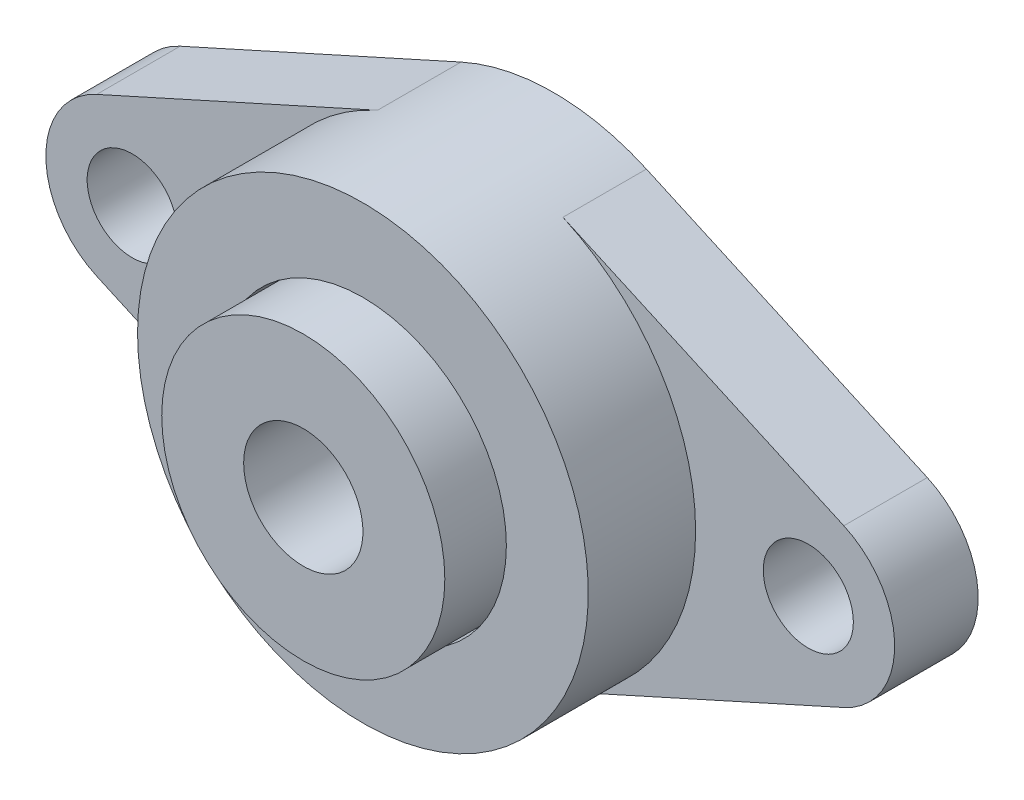
from build123d import *
from build123d.topology import SkipClean

# Parameters (mm, degrees)
SKETCH1_R        = 5.9944
EXTRUDE1_DEPTH   = 11.1125
EXTRUDE1_2_DEPTH = 11.1125
EXTRUDE2_DEPTH   = 11.1125


with BuildPart() as part:
    # Sketch1 → Extrude1 (new body)
    with BuildSketch(Plane.XY):
        with BuildLine():
            Line((-44.9961, 11.4935), (-27.708184071, 11.4935))
            ThreePointArc((-27.708184071, 11.4935), (-29.9974, 0), (-27.708184071, -11.4935))
            Line((-27.708184071, -11.4935), (-44.9961, -11.4935))
            ThreePointArc((-44.9961, -11.4935), (-56.4896, 0), (-44.9961, 11.4935))
        make_face()
        with Locations((-44.9961, 0)):
            Circle(SKETCH1_R, mode=Mode.SUBTRACT)
    extrude(amount=EXTRUDE1_DEPTH)



with BuildPart() as body_2:
    # Sketch1 → Extrude1 2 (new body)
    with BuildSketch(Plane.XY):
        with BuildLine():
            Line((44.9961, 11.4935), (27.708184071, 11.4935))
            ThreePointArc((27.708184071, 11.4935), (29.9974, 0), (27.708184071, -11.4935))
            Line((27.708184071, -11.4935), (44.9961, -11.4935))
            ThreePointArc((44.9961, -11.4935), (56.4896, 0), (44.9961, 11.4935))
        make_face()
        with Locations((44.9961, 0)):
            Circle(SKETCH1_R, mode=Mode.SUBTRACT)
    extrude(amount=EXTRUDE1_2_DEPTH)


with BuildPart() as part_1:
    with SkipClean():  # the faces are left unmerged after this step: merging them gives an invalid solid
        add(part.part)

        add(body_2.part)  # Extrude2 merges body 2
        # Sketch2 → Extrude2 (add)
        with BuildSketch(Plane.XY):
            with BuildLine():
                Line((-49.72261129, 10.476670906), (-12.335933333, 27.343532244))
                ThreePointArc((-12.335933333, 27.343532244), (-21.533432499, 20.884331245), (-27.708184071, 11.4935))
                Line((-27.708184071, 11.4935), (-44.9961, 11.4935))
                ThreePointArc((-44.9961, 11.4935), (-47.413425505, 11.236417563), (-49.72261129, 10.476670906))
            make_face()
            with BuildLine():
                Line((-44.9961, -11.4935), (-27.708184071, -11.4935))
                ThreePointArc((-27.708184071, -11.4935), (-21.533432499, -20.884331245), (-12.335933333, -27.343532244))
                Line((-12.335933333, -27.343532244), (-49.72261129, -10.476670906))
                ThreePointArc((-49.72261129, -10.476670906), (-47.413425505, -11.236417563), (-44.9961, -11.4935))
            make_face()
            with BuildLine():
                Line((12.335933333, 27.343532244), (49.72261129, 10.476670906))
                ThreePointArc((49.72261129, 10.476670906), (47.413425505, 11.236417563), (44.9961, 11.4935))
                Line((44.9961, 11.4935), (27.708184071, 11.4935))
                ThreePointArc((27.708184071, 11.4935), (21.533432499, 20.884331245), (12.335933333, 27.343532244))
            make_face()
            with BuildLine():
                Line((49.72261129, -10.476670906), (12.335933333, -27.343532244))
                ThreePointArc((12.335933333, -27.343532244), (21.533432499, -20.884331245), (27.708184071, -11.4935))
                Line((27.708184071, -11.4935), (44.9961, -11.4935))
                ThreePointArc((44.9961, -11.4935), (47.413425505, -11.236417563), (49.72261129, -10.476670906))
            make_face()
        extrude(amount=EXTRUDE2_DEPTH)

    # Sketch3 → Revolve1 (revolve)
    with BuildSketch(Plane(origin=(0, 0, 0), x_dir=(0, 0, -1), z_dir=(1, 0, 0))):
        with BuildLine():
            Line((0, 29.9974), (-25.4, 29.9974))
            Line((-25.4, 29.9974), (-25.4, 19.09445))
            Line((-25.4, 19.09445), (-15.01603347, 19.09445))
            ThreePointArc((-15.01603347, 19.09445), (-10.31875, 23.66645), (-5.62146653, 19.09445))
            Line((-5.62146653, 19.09445), (0, 19.09445))
            Line((0, 19.09445), (0, 29.9974))
        make_face()
        with BuildLine():
            Line((-33.3375, 18.84045), (-15.01603347, 18.84045))
            ThreePointArc((-15.01603347, 18.84045), (-10.31875, 14.26845), (-5.62146653, 18.84045))
            Line((-5.62146653, 18.84045), (-1.5875, 18.84045))
            Line((-1.5875, 18.84045), (-1.5875, 7.9375))
            Line((-1.5875, 7.9375), (-33.3375, 7.9375))
            Line((-33.3375, 7.9375), (-33.3375, 18.84045))
        make_face()
    revolve(axis=Axis((0, 0, 0), (0, 0, 1)))


solid = part_1.part
